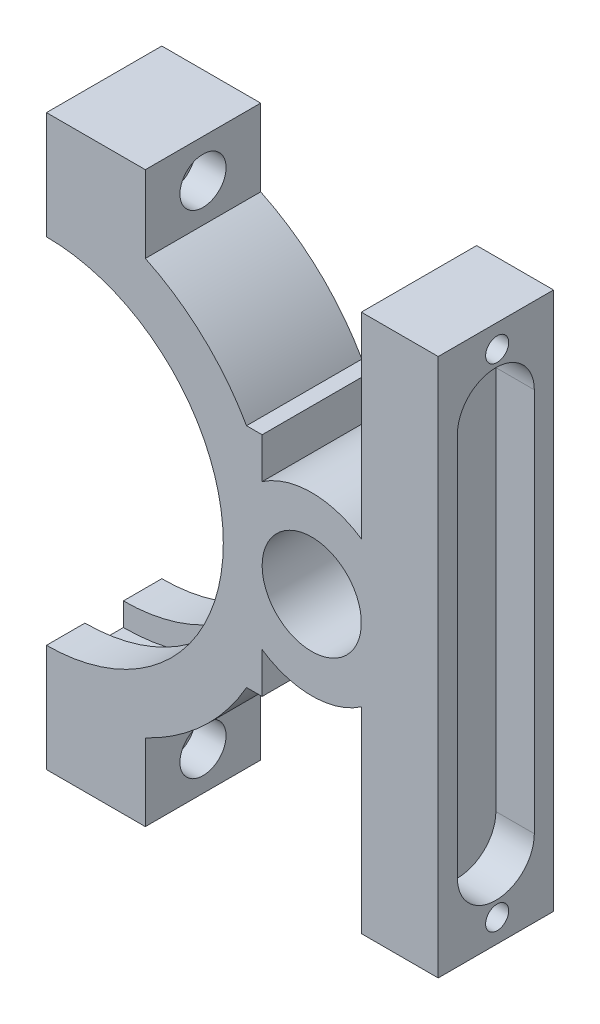
from build123d import *

# Parameters (mm, degrees)
SKETCH1_R               = 6.45
BOSS_EXTRUDE1_DEPTH     = 15
SKETCH2_W               = 5
SKETCH2_H               = 3
CUT_EXTRUDE3_DEPTH      = 5
CUT_EXTRUDE4_DEPTH      = 56.180796325
CUT_EXTRUDE4_DEPTH_BACK = 56.180796325
SKETCH4_R               = 1.5
SKETCH5_R               = 3
CUT_EXTRUDE5_DEPTH      = 4


with BuildPart() as part:
    # Sketch1 → Boss-Extrude1 (new body)
    with BuildSketch(Plane.XY):
        with BuildLine():
            Line((0, 23), (0, 37))
            Line((0, 37), (12.859510911, 37))
            Line((12.859510911, 37), (12.859510911, 27))
            ThreePointArc((12.859510911, 27), (20.383390121, 21.88342816), (26.020458433, 14.741192754))
            Line((26.020458433, 14.741192754), (28.050458433, 14.741192754))
            Line((28.050458433, 14.741192754), (28.050458433, 9.460443964))
            ThreePointArc((28.050458433, 9.460443964), (34.500458433, 11.45), (40.950458433, 9.460443964))
            Line((40.950458433, 9.460443964), (40.950458433, 35))
            Line((40.950458433, 35), (50.950458433, 35))
            Line((50.950458433, 35), (50.950458433, -35))
            Line((50.950458433, -35), (40.950458433, -35))
            Line((40.950458433, -35), (40.950458433, -9.460443964))
            ThreePointArc((40.950458433, -9.460443964), (34.500458433, -11.45), (28.050458433, -9.460443964))
            Line((28.050458433, -9.460443964), (28.050458433, -14.741192754))
            Line((28.050458433, -14.741192754), (26.020458433, -14.741192754))
            ThreePointArc((26.020458433, -14.741192754), (20.383390121, -21.88342816), (12.859510911, -27))
            Line((12.859510911, -27), (12.859510911, -37))
            Line((12.859510911, -37), (0, -37))
            Line((0, -37), (0, -23))
            ThreePointArc((0, -23), (23, 0), (0, 23))
        make_face()
        with Locations((34.500458433, 0)):
            Circle(SKETCH1_R, mode=Mode.SUBTRACT)
    extrude(amount=BOSS_EXTRUDE1_DEPTH)

    # Sketch2 → Cut-Revolve1 (revolve, cut)
    with BuildSketch(Plane.ZY):
        with Locations((7.5, 24.5)):
            Rectangle(SKETCH2_W, SKETCH2_H)
    revolve(axis=Axis((0, 0, 15), (0, 0, -1)), mode=Mode.SUBTRACT)

    # Sketch3 → Cut-Extrude3 (cut)
    with BuildSketch(Plane(origin=(50.950458433, 0, 0), x_dir=(0, 0, -1), z_dir=(1, 0, 0))):
        with BuildLine():
            Line((-12.5, -25), (-12.5, 25))
            ThreePointArc((-12.5, 25), (-7.5, 30), (-2.5, 25))
            Line((-2.5, 25), (-2.5, -25))
            ThreePointArc((-2.5, -25), (-7.5, -30), (-12.5, -25))
        make_face()
    extrude(amount=-CUT_EXTRUDE3_DEPTH, mode=Mode.SUBTRACT)

    # Sketch4 → Cut-Extrude4 (cut, two sides: drawn at the far end of the back side and taken through both)
    with BuildSketch(Plane(origin=(12.859510911, 0, 0), x_dir=(0, 0, -1), z_dir=(1, 0, 0)).offset(-CUT_EXTRUDE4_DEPTH_BACK)):
        with Locations((-7.333431897, 32)):
            Circle(SKETCH4_R)
        with Locations((-7.333431897, -32)):
            Circle(SKETCH4_R)
    extrude(amount=CUT_EXTRUDE4_DEPTH + CUT_EXTRUDE4_DEPTH_BACK, mode=Mode.SUBTRACT)

    # Sketch5 → Cut-Extrude5 (cut)
    with BuildSketch(Plane(origin=(12.859510911, 0, 0), x_dir=(0, 0, -1), z_dir=(1, 0, 0))):
        with Locations((-7.5, 32)):
            Circle(SKETCH5_R)
        with Locations((-7.5, -32)):
            Circle(SKETCH5_R)
    extrude(amount=-CUT_EXTRUDE5_DEPTH, mode=Mode.SUBTRACT)


solid = part.part
